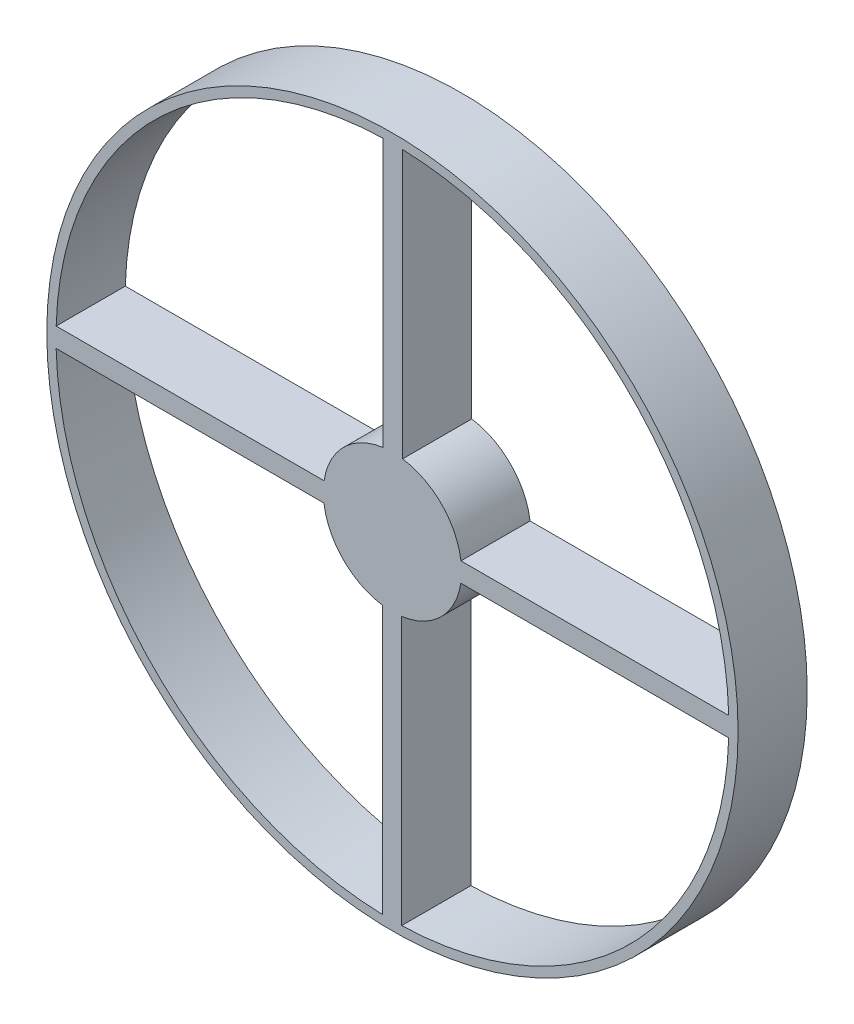
from build123d import *

# Parameters (mm, degrees)
SKETCH4_R           = 75
BOSS_EXTRUDE2_DEPTH = 15
CUT_EXTRUDE1_DEPTH  = 108.121426428
CIRPATTERN1_COUNT   = 4
SHELL1_DEPTH        = 13
SKETCH7_R           = 12.503328754
BOSS_EXTRUDE3_DEPTH = 12.5
SKETCH8_R           = 3.25
SKETCH8_R_2         = 2.25
BOSS_EXTRUDE4_DEPTH = 8.5
CUT_EXTRUDE2_START  = -10
SKETCH9_R           = 12.503328754
SKETCH9_R_2         = 3.25
CUT_EXTRUDE2_DEPTH  = 10


# Read off the part's stored shape, not the designer's step: Shell1
with BuildPart() as part:
    # Sketch4 → Boss-Extrude2 (new body)
    with BuildSketch(Plane.XY):
        Circle(SKETCH4_R)
    extrude(amount=BOSS_EXTRUDE2_DEPTH)

    # Sketch6 → Cut-Extrude1 (cut, symmetric)
    with BuildSketch(Plane.XY):
        with BuildLine():
            Line((2.206615595, 15), (2.206615595, 69.72932719))
            Line((2.206615595, 69.72932719), (2.206615595, 72.96664202))
            ThreePointArc((2.206615595, 72.96664202), (51.691823279, 51.54566331), (72.972597597, 2))
            Line((72.972597597, 2), (15, 2))
            Line((15, 2), (14.866068747, 2))
            ThreePointArc((14.866068747, 2), (10.680123706, 10.532566526), (2.206615595, 14.836807191))
            Line((2.206615595, 14.836807191), (2.206615595, 15))
        make_face()
    cut_extrude1 = extrude(amount=CUT_EXTRUDE1_DEPTH, both=True, mode=Mode.SUBTRACT)

    # CirPattern1: Cut-Extrude1 ×4 about axis
    cirpattern1_axis = Axis((0, 0, 0), (0, 0, 1))
    for i in range(1, CIRPATTERN1_COUNT):
        add(cut_extrude1.rotate(cirpattern1_axis, i * 360 / CIRPATTERN1_COUNT), mode=Mode.SUBTRACT)

    # Shell1 outline → Shell1 (cut)
    with BuildSketch(Plane.XY):
        with BuildLine():
            ThreePointArc((-0.206615595, -72.999707602), (-0.103307901, -72.9999269), (0, -73))
            Line((0, -73), (0, -13))
            ThreePointArc((0, -13), (9.119045928, -9.26514983), (12.998357973, -0.206615595))
            Line((12.998357973, -0.206615595), (72.999707602, -0.206615595))
            ThreePointArc((72.999707602, -0.206615595), (72.9999269, -0.103307901), (73, 0))
            Line((73, 0), (13, 0))
            ThreePointArc((13, 0), (9.26514983, 9.119045928), (0.206615595, 12.998357973))
            Line((0.206615595, 12.998357973), (0.206615595, 72.999707602))
            ThreePointArc((0.206615595, 72.999707602), (0.103307901, 72.9999269), (0, 73))
            Line((0, 73), (0, 13))
            ThreePointArc((0, 13), (-9.119045928, 9.26514983), (-12.998357973, 0.206615595))
            Line((-12.998357973, 0.206615595), (-72.999707602, 0.206615595))
            ThreePointArc((-72.999707602, 0.206615595), (-72.9999269, 0.103307901), (-73, 0))
            Line((-73, 0), (-13, 0))
            ThreePointArc((-13, 0), (-9.26514983, -9.119045928), (-0.206615595, -12.998357973))
            Line((-0.206615595, -12.998357973), (-0.206615595, -72.999707602))
        make_face()
    extrude(amount=SHELL1_DEPTH, mode=Mode.SUBTRACT)

    # Sketch7 → Boss-Extrude3 (add)
    with BuildSketch(Plane(origin=(0, 0, 13), x_dir=(-1, 0, 0), z_dir=(0, 0, -1))):
        with Locations(Location((0, 0, 0), (0, 0, 180))):
            Circle(SKETCH7_R)
    extrude(amount=BOSS_EXTRUDE3_DEPTH)

    # Sketch8 → Boss-Extrude4 (add)
    with BuildSketch(Plane(origin=(0, 0, 0.5), x_dir=(-1, 0, 0), z_dir=(0, 0, -1))):
        Circle(SKETCH8_R)
        Circle(SKETCH8_R_2, mode=Mode.SUBTRACT)
    extrude(amount=BOSS_EXTRUDE4_DEPTH)

    # Sketch9 → Cut-Extrude2 (cut)
    with BuildSketch(Plane(origin=(0, 0, 0.5), x_dir=(-1, 0, 0), z_dir=(0, 0, -1)).offset(CUT_EXTRUDE2_START)):
        with Locations(Location((0, 0, 0), (0, 0, 180))):
            Circle(SKETCH9_R)
        Circle(SKETCH9_R_2, mode=Mode.SUBTRACT)
    extrude(amount=CUT_EXTRUDE2_DEPTH, mode=Mode.SUBTRACT)


solid = part.part
